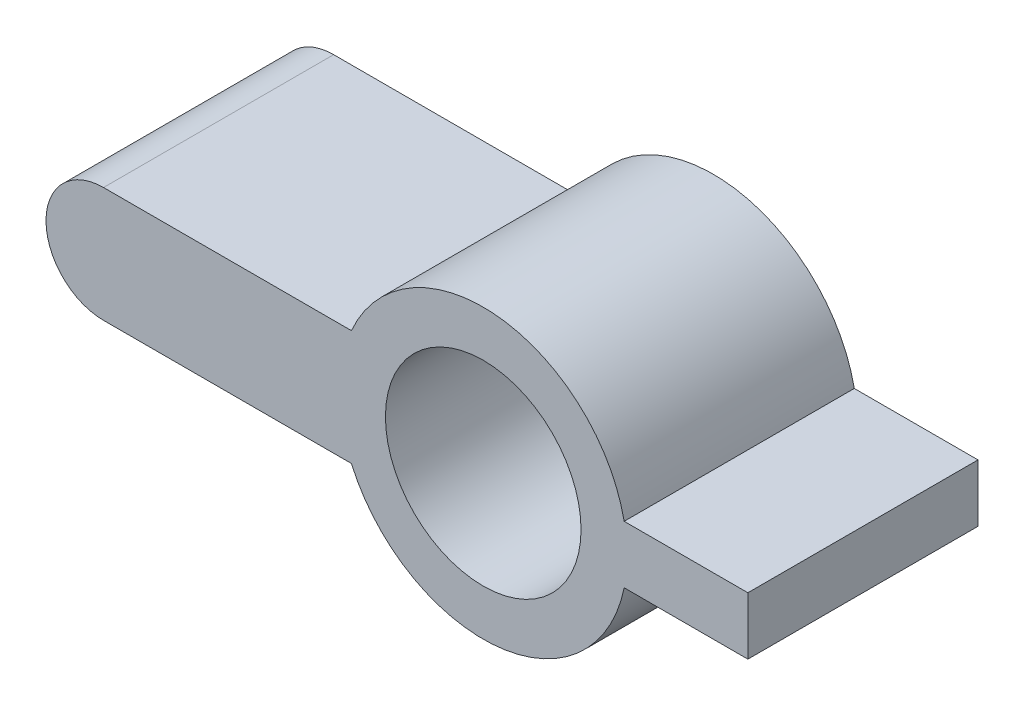
from build123d import *

# Parameters (mm, degrees)
SKETCH1_W               = 1.15
SKETCH1_H               = 1
BOSS_EXTRUDE1_DEPTH     = 0.25
SKETCH2_W               = 1
SKETCH2_H               = 0.5
BOSS_EXTRUDE2_DEPTH     = 1.9
SKETCH3_R               = 0.625
BOSS_EXTRUDE3_DEPTH     = 1
CUT_EXTRUDE1_DEPTH      = 4.296209945
CUT_EXTRUDE1_DEPTH_BACK = 4.296209945
SKETCH4_R               = 0.425
FILLET2_R               = 0.25
FILLET3_R               = 0.25


with BuildPart() as part:
    # Sketch1 → Boss-Extrude1 (new body)
    with BuildSketch(Plane(origin=(0, 0, 0), x_dir=(1, 0, 0), z_dir=(0, 1, 0))):
        with Locations((-0.575, 0.5)):
            Rectangle(SKETCH1_W, SKETCH1_H)
    extrude(amount=BOSS_EXTRUDE1_DEPTH)

    # Sketch2 → Boss-Extrude2 (add)
    with BuildSketch(Plane.ZY.offset(1.15)):
        with Locations((-0.5, 0.125)):
            Rectangle(SKETCH2_W, SKETCH2_H)
    extrude(amount=BOSS_EXTRUDE2_DEPTH)

    # Sketch3 → Boss-Extrude3 (add)
    with BuildSketch(Plane(origin=(0, 0, -1), x_dir=(-1, 0, 0), z_dir=(0, 0, -1))):
        with Locations((1.15, 0.125)):
            Circle(SKETCH3_R)
    extrude(amount=-BOSS_EXTRUDE3_DEPTH)

    # Sketch4 → Cut-Extrude1 (cut, two sides: drawn at the far end of the back side and taken through both)
    with BuildSketch(Plane.XY.offset(-CUT_EXTRUDE1_DEPTH_BACK)):
        with Locations((-1.15, 0.125)):
            Circle(SKETCH4_R)
    extrude(amount=CUT_EXTRUDE1_DEPTH + CUT_EXTRUDE1_DEPTH_BACK, mode=Mode.SUBTRACT)

    # Fillet2
    fillet2_edges = [part.edges().sort_by_distance(p)[0] for p in [
        (-3.05, 0.375, -0.5),
    ]]
    fillet(fillet2_edges, radius=FILLET2_R)

    # Fillet3
    fillet3_edges = [part.edges().sort_by_distance(p)[0] for p in [
        (-3.05, -0.125, -0.5),
    ]]
    fillet(fillet3_edges, radius=FILLET3_R - 0.0001)  # a hair under: the kernel refuses the full size


solid = part.part
